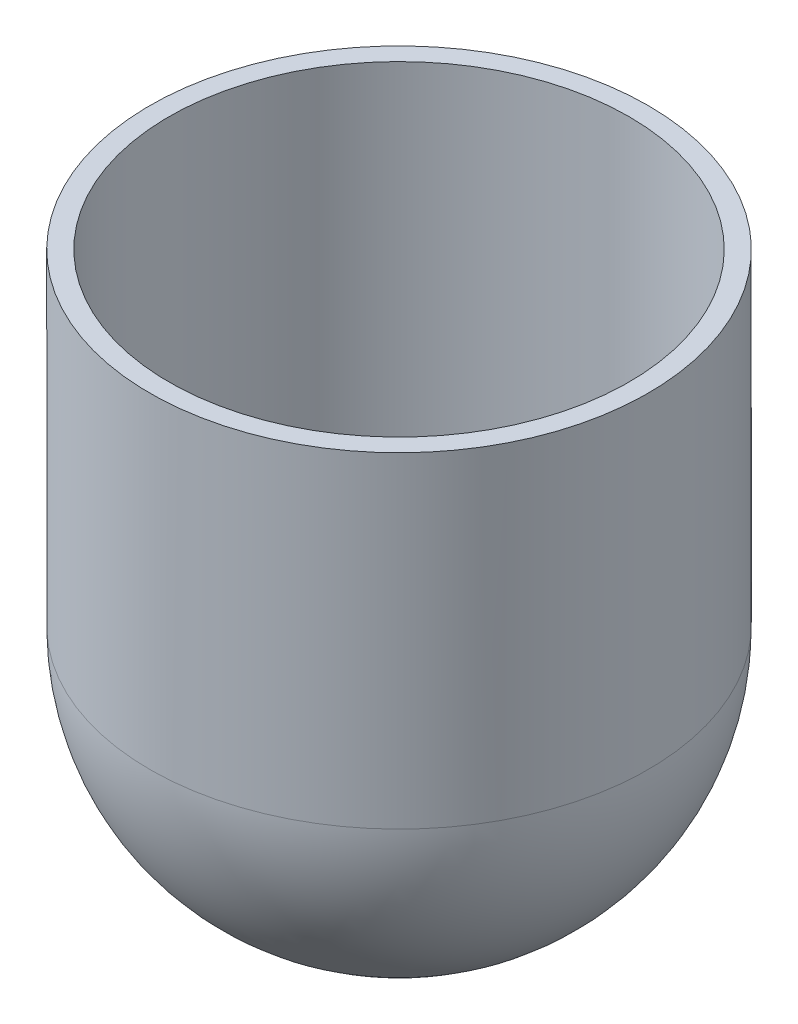
from build123d import *

# Parameters (mm, degrees)
SKETCH1_R           = 38.1
BOSS_EXTRUDE1_DEPTH = 50.827459459
SHELL2_T            = 3.175
REVOLVE1_ANGLE      = 180
SCALE1_SCALE        = 0.615384615


# Read off the part's stored shape, not the designer's step: Shell4
with BuildPart() as part:
    # Sketch1 → Boss-Extrude1 (new body)
    with BuildSketch(Plane(origin=(0, 0, 0), x_dir=(1, 0, 0), z_dir=(0, 1, 0))):
        with Locations(Location((0, 0, 0), (0, 0, 90))):
            Circle(SKETCH1_R)
    extrude(amount=BOSS_EXTRUDE1_DEPTH)

    # Shell2
    shell2_openings = [part.faces().sort_by_distance(p)[0] for p in [
        (0, 50.827459459, 0),
    ]]
    offset(amount=SHELL2_T, openings=shell2_openings, kind=Kind.INTERSECTION)

    # Sketch5 → Revolve1 (revolve)
    with BuildSketch(Plane.XZ.offset(3.175)):
        with BuildLine():
            Line((-40.445113765, 8.235192624), (40.445113765, -8.235192624))
            ThreePointArc((40.445113765, -8.235192624), (-8.235192624, -40.445113765), (-40.445113765, 8.235192624))
        make_face()
    revolve(axis=Axis((-40.445113765, -3.175, 8.235192624), (-0.979893731431563, 0, 0.19952011202164077)), revolution_arc=REVOLVE1_ANGLE)

    # Shell4 outline → Shell4 (revolve, cut)
    with BuildSketch(Plane.XY):
        with BuildLine():
            ThreePointArc((0, -41.275), (26.940768377, -30.11576835), (38.1, -3.174999962))
            Line((38.1, -3.174999962), (38.1, 0))
            Line((38.1, 0), (0, 0))
            Line((0, 0), (0, -41.275))
        make_face()
    revolve(axis=Axis((0, 0, 0), (0, 1, 0)), mode=Mode.SUBTRACT)


with BuildPart() as part_1:
    # Scale1: scaled about (-2e-09, 3.96741665, 0)
    add(part.part.scale(SCALE1_SCALE).moved(Location((-1e-09, 1.525929481, 0))))


solid = part_1.part
